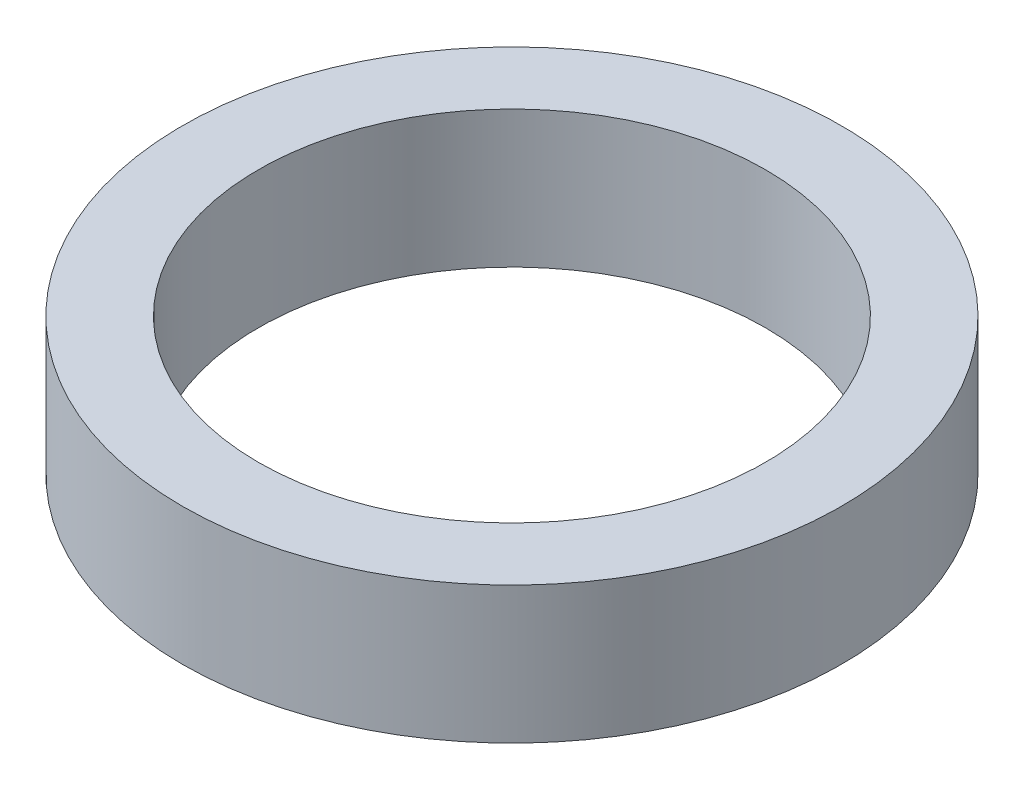
from build123d import *

# Parameters (mm, degrees)
SKETCH1_R           = 65
BOSS_EXTRUDE1_DEPTH = 27
SKETCH2_R           = 50
CUT_EXTRUDE1_DEPTH  = 96.807097858


with BuildPart() as part:
    # Sketch1 → Boss-Extrude1 (new body)
    with BuildSketch(Plane(origin=(0, 0, 0), x_dir=(1, 0, 0), z_dir=(0, 1, 0))):
        Circle(SKETCH1_R)
    extrude(amount=BOSS_EXTRUDE1_DEPTH)

    # Sketch2 → Cut-Extrude1 (cut, through all)
    with BuildSketch(Plane(origin=(0, 0, 0), x_dir=(1, 0, 0), z_dir=(0, 1, 0))):
        Circle(SKETCH2_R)
    extrude(amount=CUT_EXTRUDE1_DEPTH, mode=Mode.SUBTRACT)


solid = part.part
